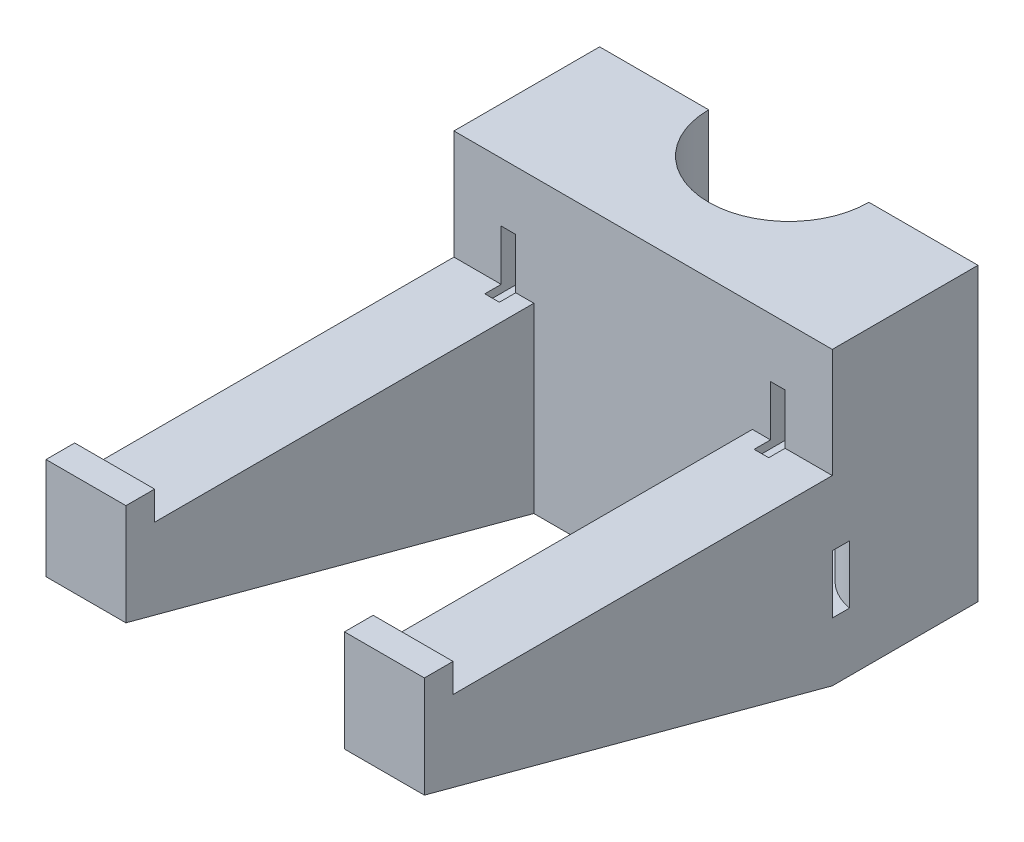
from build123d import *

# Parameters (mm, degrees)
BOSS_EXTRUDE1_DEPTH = 50.8
SKETCH1_4_W         = 13.934163053
SKETCH1_4_H         = 71.12
BOSS_EXTRUDE2_DEPTH = 50.8
CUT_EXTRUDE1_START  = -32.984163053
CUT_EXTRUDE1_DEPTH  = 65.968326106
SKETCH3_R           = 3.937
SKETCH3_W           = 2.54
SKETCH3_H           = 10.16
CUT_EXTRUDE2_DEPTH  = 8.255
SKETCH3_2_W         = 2.54
SKETCH3_2_H         = 10.16
CUT_EXTRUDE3_DEPTH  = 28.255
CUT_EXTRUDE4_START  = 32.984163
CUT_EXTRUDE4_DEPTH  = 10.775
CUT_EXTRUDE5_START  = -22.209163
CUT_EXTRUDE5_DEPTH  = 10.775
FILLET1_R           = 10


# Read off the part's stored shape, not the designer's step: Cut-Extrude1
with BuildPart() as part:
    # Sketch1 → Boss-Extrude1 (new body)
    with BuildSketch(Plane(origin=(0, 0, 0), x_dir=(1, 0, 0), z_dir=(0, 1, 0))):
        with BuildLine():
            ThreePointArc((13.97, 0), (0, -13.97), (-13.97, 0))
            Line((-13.97, 0), (-32.984163053, 0))
            Line((-32.984163053, 0), (-32.984163053, -25.4))
            Line((-32.984163053, -25.4), (-19.05, -25.4))
            Line((-19.05, -25.4), (19.05, -25.4))
            Line((19.05, -25.4), (32.984163053, -25.4))
            Line((32.984163053, -25.4), (32.984163053, 0))
            Line((32.984163053, 0), (13.97, 0))
        make_face()
    extrude(amount=BOSS_EXTRUDE1_DEPTH)

    # Sketch1<4> → Boss-Extrude2 (add)
    with BuildSketch(Plane(origin=(0, 0, 0), x_dir=(1, 0, 0), z_dir=(0, 1, 0))):
        with Locations((-26.017081527, -60.96)):
            Rectangle(SKETCH1_4_W, SKETCH1_4_H)
        with Locations((26.017081527, -60.96)):
            Rectangle(SKETCH1_4_W, SKETCH1_4_H)
    extrude(amount=BOSS_EXTRUDE2_DEPTH)

    # Cut-Extrude1 outline → Cut-Extrude1 (cut)
    with BuildSketch(Plane(origin=(0, 0, 0), x_dir=(0, 0, -1), z_dir=(1, 0, 0)).offset(CUT_EXTRUDE1_START)):
        Polygon((-96.52, 0), (-25.4, 0), (-96.52, 19.05), align=None)
        Polygon((-91.52, 31.75), (-25.4, 31.75), (-25.4, 50.8), (-96.52, 50.8), (-96.52, 36.75), (-91.52, 36.75), align=None)
    extrude(amount=CUT_EXTRUDE1_DEPTH, mode=Mode.SUBTRACT)

    # Sketch3 → Cut-Extrude2 (cut)
    with BuildSketch(Plane.XY):
        with Locations((23.479163053, 25.4)):
            Circle(SKETCH3_R)
        with Locations((-23.479163053, 25.4)):
            Circle(SKETCH3_R)
        with Locations((23.479163053, 35.48)):
            Rectangle(SKETCH3_W, SKETCH3_H)
        with Locations((-23.479163053, 35.48)):
            Rectangle(SKETCH3_W, SKETCH3_H)
        with Locations((-23.479163053, 15.32)):
            Rectangle(SKETCH3_W, SKETCH3_H)
        with Locations((23.479163053, 15.32)):
            Rectangle(SKETCH3_W, SKETCH3_H)
    extrude(amount=CUT_EXTRUDE2_DEPTH, mode=Mode.SUBTRACT)

    # Sketch3<2> → Cut-Extrude3 (cut)
    with BuildSketch(Plane.XY):
        with Locations((23.479163053, 35.48)):
            Rectangle(SKETCH3_2_W, SKETCH3_2_H)
        with Locations((-23.479163053, 35.48)):
            Rectangle(SKETCH3_2_W, SKETCH3_2_H)
        with Locations((23.479163053, 15.32)):
            Rectangle(SKETCH3_2_W, SKETCH3_2_H)
        with Locations((-23.479163053, 15.32)):
            Rectangle(SKETCH3_2_W, SKETCH3_2_H)
    extrude(amount=CUT_EXTRUDE3_DEPTH, mode=Mode.SUBTRACT)

    # Sketch2<4> → Cut-Extrude4 (cut)
    with BuildSketch(Plane(origin=(0, 0, 0), x_dir=(0, 0, -1), z_dir=(1, 0, 0)).offset(CUT_EXTRUDE4_START)):
        Polygon((-22.4, 20.4), (-25.4, 20.4), (-25.4, 19.05), (-25.4, 10.24), (-22.4, 10.24), align=None)
    extrude(amount=-CUT_EXTRUDE4_DEPTH, mode=Mode.SUBTRACT)

    # Sketch2<5> → Cut-Extrude5 (cut)
    with BuildSketch(Plane(origin=(0, 0, 0), x_dir=(0, 0, -1), z_dir=(1, 0, 0)).offset(CUT_EXTRUDE5_START)):
        Polygon((-22.4, 20.4), (-25.4, 20.4), (-25.4, 19.05), (-25.4, 10.24), (-22.4, 10.24), align=None)
    extrude(amount=-CUT_EXTRUDE5_DEPTH, mode=Mode.SUBTRACT)

    # Fillet1
    # the kernel refuses this fillet: 10 mm, written as the material it adds along each edge
    with BuildSketch(Plane(origin=(22.209163053, 10.24, 28.255), x_dir=(0, 0, -1), z_dir=(0, 1, 0)), Plane(origin=(-22.209163053, 20.4, 28.255), x_dir=(0, 0, -1), z_dir=(0, -1, 0))) as fillet1_piece_1:
        with BuildLine():
            CenterArc((6.659459438, -10), FILLET1_R, 90, 41.754936598)
            Line((0, -2.54), (0, 0))
            Line((0, 0), (6.659459438, 0))
        make_face()
    extrude(amount=10.16)
    # the kernel refuses this fillet: 10 mm, written as the material it takes off along each edge
    with BuildSketch(Plane(origin=(-24.749163053, 20.4, 22.4), x_dir=(0, 0, -1), z_dir=(0, -1, 0))) as fillet1_2_piece_1:
        with BuildLine():
            CenterArc((9.843006391, -10), FILLET1_R, 90, 79.834039024)
            Line((0, -8.234999947), (0, 0))
            Line((0, 0), (9.843006391, 0))
        make_face()
    extrude(amount=10.16, mode=Mode.SUBTRACT)
    with BuildSketch(Plane(origin=(24.749163053, 20.4, 22.4), x_dir=(0, 0, -1), z_dir=(0, -1, 0))) as fillet1_2_piece_2:
        with BuildLine():
            CenterArc((9.843006391, 10), FILLET1_R, 190.165960976, 79.834039024)
            Line((0, 8.234999947), (0, 0))
            Line((0, 0), (9.843006391, 0))
        make_face()
    extrude(amount=10.16, mode=Mode.SUBTRACT)


solid = part.part
